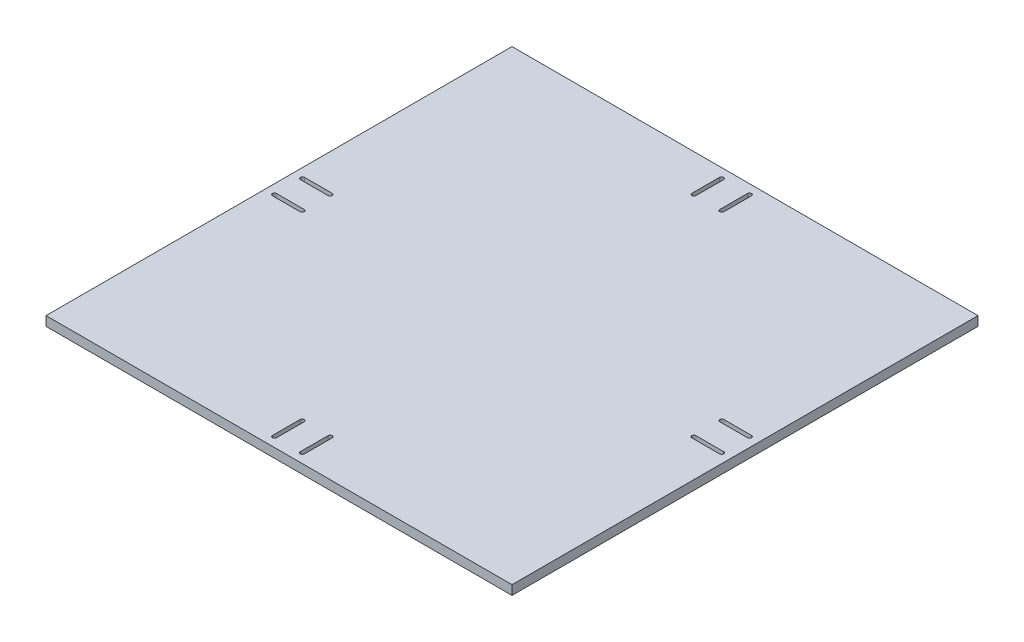
from build123d import *

# Parameters (mm, degrees)
ESBO_O1_W                  = 500
ESBO_O1_H                  = 500
RESSALTO_EXTRUS_O1_DEPTH   = 10
CORTE_EXTRUS_O2_DEPTH      = 708.177488329
CORTE_EXTRUS_O2_DEPTH_BACK = 708.177488329


with BuildPart() as part:
    # Esboço1 → Ressalto-extrusão1 (new body)
    with BuildSketch(Plane(origin=(0, 0, 0), x_dir=(1, 0, 0), z_dir=(0, 1, 0))):
        with Locations((250, 250)):
            Rectangle(ESBO_O1_W, ESBO_O1_H)
    extrude(amount=RESSALTO_EXTRUS_O1_DEPTH)

    # Esboço2 → Corte-extrusão2 (cut, two sides: drawn at the far end of the back side and taken through both)
    with BuildSketch(Plane(origin=(0, 10, 0), x_dir=(1, 0, 0), z_dir=(0, 1, 0)).offset(-CORTE_EXTRUS_O2_DEPTH_BACK)):
        with BuildLine():
            Line((232.85, 489.85), (232.85, 460.15))
            ThreePointArc((232.85, 460.15), (235, 458), (237.15, 460.15))
            Line((237.15, 460.15), (237.15, 489.85))
            ThreePointArc((237.15, 489.85), (235, 492), (232.85, 489.85))
        make_face()
        with BuildLine():
            Line((262.85, 489.85), (262.85, 460.15))
            ThreePointArc((262.85, 460.15), (265, 458), (267.15, 460.15))
            Line((267.15, 460.15), (267.15, 489.85))
            ThreePointArc((267.15, 489.85), (265, 492), (262.85, 489.85))
        make_face()
        with BuildLine():
            Line((489.85, 267.15), (460.15, 267.15))
            ThreePointArc((460.15, 267.15), (458, 265), (460.15, 262.85))
            Line((460.15, 262.85), (489.85, 262.85))
            ThreePointArc((489.85, 262.85), (492, 265), (489.85, 267.15))
        make_face()
        with BuildLine():
            Line((489.85, 237.15), (460.15, 237.15))
            ThreePointArc((460.15, 237.15), (458, 235), (460.15, 232.85))
            Line((460.15, 232.85), (489.85, 232.85))
            ThreePointArc((489.85, 232.85), (492, 235), (489.85, 237.15))
        make_face()
        with BuildLine():
            Line((267.15, 10.15), (267.15, 39.85))
            ThreePointArc((267.15, 39.85), (265, 42), (262.85, 39.85))
            Line((262.85, 39.85), (262.85, 10.15))
            ThreePointArc((262.85, 10.15), (265, 8), (267.15, 10.15))
        make_face()
        with BuildLine():
            Line((237.15, 10.15), (237.15, 39.85))
            ThreePointArc((237.15, 39.85), (235, 42), (232.85, 39.85))
            Line((232.85, 39.85), (232.85, 10.15))
            ThreePointArc((232.85, 10.15), (235, 8), (237.15, 10.15))
        make_face()
        with BuildLine():
            Line((10.15, 232.85), (39.85, 232.85))
            ThreePointArc((39.85, 232.85), (42, 235), (39.85, 237.15))
            Line((39.85, 237.15), (10.15, 237.15))
            ThreePointArc((10.15, 237.15), (8, 235), (10.15, 232.85))
        make_face()
        with BuildLine():
            Line((10.15, 262.85), (39.85, 262.85))
            ThreePointArc((39.85, 262.85), (42, 265), (39.85, 267.15))
            Line((39.85, 267.15), (10.15, 267.15))
            ThreePointArc((10.15, 267.15), (8, 265), (10.15, 262.85))
        make_face()
    extrude(amount=CORTE_EXTRUS_O2_DEPTH + CORTE_EXTRUS_O2_DEPTH_BACK, mode=Mode.SUBTRACT)


solid = part.part
